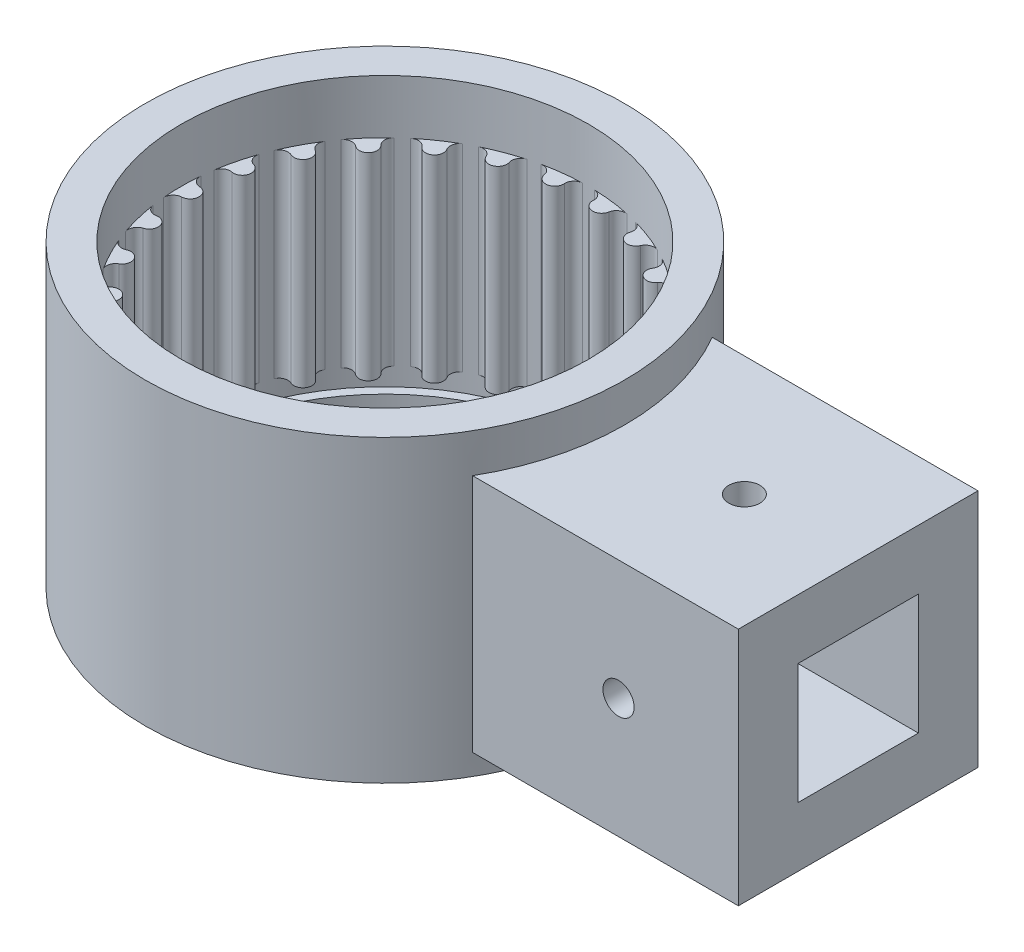
from build123d import *

# Parameters (mm, degrees)
SKETCH1_R                = 40
SKETCH1_R_2              = 34
BOSS_EXTRUDE1_DEPTH      = 50
BOSS_EXTRUDE2_START      = -33
BOSS_EXTRUDE2_DEPTH      = 33
BOSS_EXTRUDE3_REACH      = 137.133
BOSS_EXTRUDE3_END_RADIUS = 40
SKETCH5_W                = 40
SKETCH5_H                = 40
SKETCH5_W_2              = 20.1
SKETCH5_H_2              = 20.1
SKETCH6_R                = 2.6
CUT_EXTRUDE1_DEPTH       = 99.65723491
SKETCH8_R                = 2.6
CUT_EXTRUDE2_DEPTH       = 112.09005356
SKETCH10_R               = 40
SKETCH10_R_2             = 32.5
BOSS_EXTRUDE4_DEPTH      = 5


with BuildPart() as part:
    # Sketch1 → Boss-Extrude1 (new body)
    with BuildSketch(Plane(origin=(0, 0, 0), x_dir=(1, 0, 0), z_dir=(0, 1, 0))):
        Circle(SKETCH1_R)
        Circle(SKETCH1_R_2, mode=Mode.SUBTRACT)
    extrude(amount=BOSS_EXTRUDE1_DEPTH)

    # Sketch3 → Boss-Extrude2 (add)
    with BuildSketch(Plane(origin=(0, 41, 0), x_dir=(1, 0, 0), z_dir=(0, 1, 0)).offset(BOSS_EXTRUDE2_START)):
        with BuildLine():
            ThreePointArc((33.855147929, -3.135117016), (34, 0), (33.855147929, 3.135117016))
            ThreePointArc((33.855147929, 3.135117016), (33.493053733, 2.012083176), (32.430769231, 1.498401515))
            ThreePointArc((32.430769231, 1.498401515), (31, 0), (32.430769231, -1.498401515))
            ThreePointArc((32.430769231, -1.498401515), (33.493053733, -2.012083176), (33.855147929, -3.135117016))
        make_face()
        with BuildLine():
            ThreePointArc((31.846980971, 6.306330391), (33.001329485, 6.061796707), (33.621661471, 5.058051003))
            ThreePointArc((33.621661471, 5.058051003), (33.012021792, 8.136732586), (32.121096248, 11.14608343))
            ThreePointArc((32.121096248, 11.14608343), (32.038283441, 9.969028099), (31.129799063, 9.216051772))
            ThreePointArc((31.129799063, 9.216051772), (30.09919634, 7.418785593), (31.846980971, 6.306330391))
        make_face()
        with BuildLine():
            ThreePointArc((32.121096248, -11.14608343), (33.012021792, -8.136732586), (33.621661471, -5.058051003))
            ThreePointArc((33.621661471, -5.058051003), (33.001329485, -6.061796707), (31.846980971, -6.306330391))
            ThreePointArc((31.846980971, -6.306330391), (30.09919634, -7.418785593), (31.129799063, -9.216051772))
            ThreePointArc((31.129799063, -9.216051772), (32.038283441, -9.969028099), (32.121096248, -11.14608343))
        make_face()
        with BuildLine():
            ThreePointArc((29.412361937, 13.744561298), (30.591687921, 13.783387), (31.434206258, 12.957263482))
            ThreePointArc((31.434206258, 12.957263482), (30.105504872, 15.800587849), (28.520283209, 18.509279989))
            ThreePointArc((28.520283209, 18.509279989), (28.721564569, 17.346609345), (28.019678127, 16.398098599))
            ThreePointArc((28.019678127, 16.398098599), (27.449136795, 14.406418333), (29.412361937, 13.744561298))
        make_face()
        with BuildLine():
            ThreePointArc((28.520283209, -18.509279989), (30.105504872, -15.800587849), (31.434206258, -12.957263482))
            ThreePointArc((31.434206258, -12.957263482), (30.591687921, -13.783387), (29.412361937, -13.744561298))
            ThreePointArc((29.412361937, -13.744561298), (27.449136795, -14.406418333), (28.019678127, -16.398098599))
            ThreePointArc((28.019678127, -16.398098599), (28.721564569, -17.346609345), (28.520283209, -18.509279989))
        make_face()
        with BuildLine():
            ThreePointArc((25.268403337, 20.384008262), (26.404168653, 20.70393694), (27.419909236, 20.103446906))
            ThreePointArc((27.419909236, 20.103446906), (25.449365438, 22.54617038), (23.261974976, 24.796784473))
            ThreePointArc((23.261974976, 24.796784473), (23.735652764, 23.716068708), (23.281155345, 22.62714754))
            ThreePointArc((23.281155345, 22.62714754), (23.203833193, 20.556802405), (25.268403337, 20.384008262))
        make_face()
        with BuildLine():
            ThreePointArc((23.261974976, -24.796784473), (25.449365438, -22.54617038), (27.419909236, -20.103446906))
            ThreePointArc((27.419909236, -20.103446906), (26.404168653, -20.70393694), (25.268403337, -20.384008262))
            ThreePointArc((25.268403337, -20.384008262), (23.203833193, -20.556802405), (23.281155345, -22.62714754))
            ThreePointArc((23.281155345, -22.62714754), (23.735652764, -23.716068708), (23.261974976, -24.796784473))
        make_face()
        with BuildLine():
            ThreePointArc((19.655936981, 25.838810758), (20.682135077, 26.421249322), (21.812066756, 26.081291069))
            ThreePointArc((21.812066756, 26.081291069), (19.314201389, 27.98145144), (16.651765312, 29.643189977))
            ThreePointArc((16.651765312, 29.643189977), (17.370311095, 28.707236362), (17.189616438, 27.541188913))
            ThreePointArc((17.189616438, 27.541188913), (17.610007149, 25.512499843), (19.655936981, 25.838810758))
        make_face()
        with BuildLine():
            ThreePointArc((16.651765312, -29.643189977), (19.314201389, -27.98145144), (21.812066756, -26.081291069))
            ThreePointArc((21.812066756, -26.081291069), (20.682135077, -26.421249322), (19.655936981, -25.838810758))
            ThreePointArc((19.655936981, -25.838810758), (17.610007149, -25.512499843), (17.189616438, -27.541188913))
            ThreePointArc((17.189616438, -27.541188913), (17.370311095, -28.707236362), (16.651765312, -29.643189977))
        make_face()
        with BuildLine():
            ThreePointArc((12.901139015, 29.791955494), (13.758130987, 30.60305473), (14.93658624, 30.543385397))
            ThreePointArc((14.93658624, 30.543385397), (12.056566159, 31.790552251), (9.073815574, 32.766841028))
            ThreePointArc((9.073815574, 32.766841028), (9.995470084, 32.030043785), (10.099079505, 30.854636494))
            ThreePointArc((10.099079505, 30.854636494), (10.992751498, 28.985503523), (12.901139015, 29.791955494))
        make_face()
        with BuildLine():
            ThreePointArc((9.073815574, -32.766841028), (12.056566159, -31.790552251), (14.93658624, -30.543385397))
            ThreePointArc((14.93658624, -30.543385397), (13.758130987, -30.60305473), (12.901139015, -29.791955494))
            ThreePointArc((12.901139015, -29.791955494), (10.992751498, -28.985503523), (10.099079505, -30.854636494))
            ThreePointArc((10.099079505, -30.854636494), (9.995470084, -32.030043785), (9.073815574, -32.766841028))
        make_face()
        with BuildLine():
            ThreePointArc((5.396573742, 32.013700065), (6.034554333, 33.006321835), (7.193045624, 33.230409186))
            ThreePointArc((7.193045624, 33.230409186), (4.098247129, 33.752101719), (0.968528657, 33.98620238))
            ThreePointArc((0.968528657, 33.98620238), (2.039728684, 33.491381488), (2.42162078, 32.374924754))
            ThreePointArc((2.42162078, 32.374924754), (3.736637088, 30.773975097), (5.396573742, 32.013700065))
        make_face()
        with BuildLine():
            ThreePointArc((0.968528657, -33.98620238), (4.098247129, -33.752101719), (7.193045624, -33.230409186))
            ThreePointArc((7.193045624, -33.230409186), (6.034554333, -33.006321835), (5.396573742, -32.013700065))
            ThreePointArc((5.396573742, -32.013700065), (3.736637088, -30.773975097), (2.42162078, -32.374924754))
            ThreePointArc((2.42162078, -32.374924754), (2.039728684, -33.491381488), (0.968528657, -33.98620238))
        make_face()
        with BuildLine():
            ThreePointArc((-2.42162078, 32.374924754), (-2.039728684, 33.491381488), (-0.968528657, 33.98620238))
            ThreePointArc((-0.968528657, 33.98620238), (-4.098247129, 33.752101719), (-7.193045624, 33.230409186))
            ThreePointArc((-7.193045624, 33.230409186), (-6.034554333, 33.006321835), (-5.396573742, 32.013700065))
            ThreePointArc((-5.396573742, 32.013700065), (-3.736637088, 30.773975097), (-2.42162078, 32.374924754))
        make_face()
        with BuildLine():
            ThreePointArc((-7.193045624, -33.230409186), (-4.098247129, -33.752101719), (-0.968528657, -33.98620238))
            ThreePointArc((-0.968528657, -33.98620238), (-2.039728684, -33.491381488), (-2.42162078, -32.374924754))
            ThreePointArc((-2.42162078, -32.374924754), (-3.736637088, -30.773975097), (-5.396573742, -32.013700065))
            ThreePointArc((-5.396573742, -32.013700065), (-6.034554333, -33.006321835), (-7.193045624, -33.230409186))
        make_face()
        with BuildLine():
            ThreePointArc((-10.099079505, 30.854636494), (-9.995470084, 32.030043785), (-9.073815574, 32.766841028))
            ThreePointArc((-9.073815574, 32.766841028), (-12.056566159, 31.790552251), (-14.93658624, 30.543385397))
            ThreePointArc((-14.93658624, 30.543385397), (-13.758130987, 30.60305473), (-12.901139015, 29.791955494))
            ThreePointArc((-12.901139015, 29.791955494), (-10.992751498, 28.985503523), (-10.099079505, 30.854636494))
        make_face()
        with BuildLine():
            ThreePointArc((-14.93658624, -30.543385397), (-12.056566159, -31.790552251), (-9.073815574, -32.766841028))
            ThreePointArc((-9.073815574, -32.766841028), (-9.995470084, -32.030043785), (-10.099079505, -30.854636494))
            ThreePointArc((-10.099079505, -30.854636494), (-10.992751498, -28.985503523), (-12.901139015, -29.791955494))
            ThreePointArc((-12.901139015, -29.791955494), (-13.758130987, -30.60305473), (-14.93658624, -30.543385397))
        make_face()
        with BuildLine():
            ThreePointArc((-17.189616438, 27.541188913), (-17.370311095, 28.707236362), (-16.651765312, 29.643189977))
            ThreePointArc((-16.651765312, 29.643189977), (-19.314201389, 27.98145144), (-21.812066756, 26.081291069))
            ThreePointArc((-21.812066756, 26.081291069), (-20.682135077, 26.421249322), (-19.655936981, 25.838810758))
            ThreePointArc((-19.655936981, 25.838810758), (-17.610007149, 25.512499843), (-17.189616438, 27.541188913))
        make_face()
        with BuildLine():
            ThreePointArc((-21.812066756, -26.081291069), (-19.314201389, -27.98145144), (-16.651765312, -29.643189977))
            ThreePointArc((-16.651765312, -29.643189977), (-17.370311095, -28.707236362), (-17.189616438, -27.541188913))
            ThreePointArc((-17.189616438, -27.541188913), (-17.610007149, -25.512499843), (-19.655936981, -25.838810758))
            ThreePointArc((-19.655936981, -25.838810758), (-20.682135077, -26.421249322), (-21.812066756, -26.081291069))
        make_face()
        with BuildLine():
            ThreePointArc((-23.281155345, 22.62714754), (-23.735652764, 23.716068708), (-23.261974976, 24.796784473))
            ThreePointArc((-23.261974976, 24.796784473), (-25.449365438, 22.54617038), (-27.419909236, 20.103446906))
            ThreePointArc((-27.419909236, 20.103446906), (-26.404168653, 20.70393694), (-25.268403337, 20.384008262))
            ThreePointArc((-25.268403337, 20.384008262), (-23.203833193, 20.556802405), (-23.281155345, 22.62714754))
        make_face()
        with BuildLine():
            ThreePointArc((-27.419909236, -20.103446906), (-25.449365438, -22.54617038), (-23.261974976, -24.796784473))
            ThreePointArc((-23.261974976, -24.796784473), (-23.735652764, -23.716068708), (-23.281155345, -22.62714754))
            ThreePointArc((-23.281155345, -22.62714754), (-23.203833193, -20.556802405), (-25.268403337, -20.384008262))
            ThreePointArc((-25.268403337, -20.384008262), (-26.404168653, -20.70393694), (-27.419909236, -20.103446906))
        make_face()
        with BuildLine():
            ThreePointArc((-28.019678127, 16.398098599), (-28.721564569, 17.346609345), (-28.520283209, 18.509279989))
            ThreePointArc((-28.520283209, 18.509279989), (-30.105504872, 15.800587849), (-31.434206258, 12.957263482))
            ThreePointArc((-31.434206258, 12.957263482), (-30.591687921, 13.783387), (-29.412361937, 13.744561298))
            ThreePointArc((-29.412361937, 13.744561298), (-27.449136795, 14.406418333), (-28.019678127, 16.398098599))
        make_face()
        with BuildLine():
            ThreePointArc((-31.434206258, -12.957263482), (-30.105504872, -15.800587849), (-28.520283209, -18.509279989))
            ThreePointArc((-28.520283209, -18.509279989), (-28.721564569, -17.346609345), (-28.019678127, -16.398098599))
            ThreePointArc((-28.019678127, -16.398098599), (-27.449136795, -14.406418333), (-29.412361937, -13.744561298))
            ThreePointArc((-29.412361937, -13.744561298), (-30.591687921, -13.783387), (-31.434206258, -12.957263482))
        make_face()
        with BuildLine():
            ThreePointArc((-31.129799063, 9.216051772), (-32.038283441, 9.969028099), (-32.121096248, 11.14608343))
            ThreePointArc((-32.121096248, 11.14608343), (-33.012021792, 8.136732586), (-33.621661471, 5.058051003))
            ThreePointArc((-33.621661471, 5.058051003), (-33.001329485, 6.061796707), (-31.846980971, 6.306330391))
            ThreePointArc((-31.846980971, 6.306330391), (-30.09919634, 7.418785593), (-31.129799063, 9.216051772))
        make_face()
        with BuildLine():
            ThreePointArc((-33.621661471, -5.058051003), (-33.012021792, -8.136732586), (-32.121096248, -11.14608343))
            ThreePointArc((-32.121096248, -11.14608343), (-32.038283441, -9.969028099), (-31.129799063, -9.216051772))
            ThreePointArc((-31.129799063, -9.216051772), (-30.09919634, -7.418785593), (-31.846980971, -6.306330391))
            ThreePointArc((-31.846980971, -6.306330391), (-33.001329485, -6.061796707), (-33.621661471, -5.058051003))
        make_face()
        with BuildLine():
            ThreePointArc((-32.430769231, 1.498401515), (-33.493053733, 2.012083176), (-33.855147929, 3.135117016))
            ThreePointArc((-33.855147929, 3.135117016), (-34, 0), (-33.855147929, -3.135117016))
            ThreePointArc((-33.855147929, -3.135117016), (-33.493053733, -2.012083176), (-32.430769231, -1.498401515))
            ThreePointArc((-32.430769231, -1.498401515), (-31, 0), (-32.430769231, 1.498401515))
        make_face()
    extrude(amount=BOSS_EXTRUDE2_DEPTH)

    # Boss-Extrude3: up to this cylinder (the profile starts outside it)
    boss_extrude3_end = Plane(origin=(0, 42.934315, 0), z_dir=(0, -1, 0)) * Cylinder(BOSS_EXTRUDE3_END_RADIUS, 355.266, mode=Mode.PRIVATE)
    # Sketch5 → Boss-Extrude3 (add, up to the surface)
    with BuildSketch(Plane(origin=(79, 0, 0), x_dir=(0, 0, -1), z_dir=(1, 0, 0)), mode=Mode.PRIVATE) as boss_extrude3_sk1:
        with Locations((0, 23.5)):
            Rectangle(SKETCH5_W, SKETCH5_H)
        with Locations((0, 23.5)):
            Rectangle(SKETCH5_W_2, SKETCH5_H_2, mode=Mode.SUBTRACT)
    boss_extrude3_tool1 = extrude(boss_extrude3_sk1.sketch, amount=-BOSS_EXTRUDE3_REACH, mode=Mode.PRIVATE) - boss_extrude3_end
    add(boss_extrude3_tool1.solids().sort_by_distance((79, 42.934315, 0))[0])

    # Sketch6 → Cut-Extrude1 (cut, through all)
    with BuildSketch(Plane(origin=(0, 43.5, 0), x_dir=(1, 0, 0), z_dir=(0, 1, 0))):
        with Locations((60, 0)):
            Circle(SKETCH6_R)
    extrude(amount=-CUT_EXTRUDE1_DEPTH, mode=Mode.SUBTRACT)

    # Sketch8 → Cut-Extrude2 (cut, through all)
    with BuildSketch(Plane.XY.offset(20)):
        with Locations((59, 23.5)):
            Circle(SKETCH8_R)
    extrude(amount=-CUT_EXTRUDE2_DEPTH, mode=Mode.SUBTRACT)

    # Sketch10 → Boss-Extrude4 (add)
    with BuildSketch(Plane(origin=(0, 0, 0), x_dir=(-1, 0, 0), z_dir=(0, -1, 0))):
        Circle(SKETCH10_R)
        Circle(SKETCH10_R_2, mode=Mode.SUBTRACT)
    extrude(amount=-BOSS_EXTRUDE4_DEPTH)


solid = part.part
